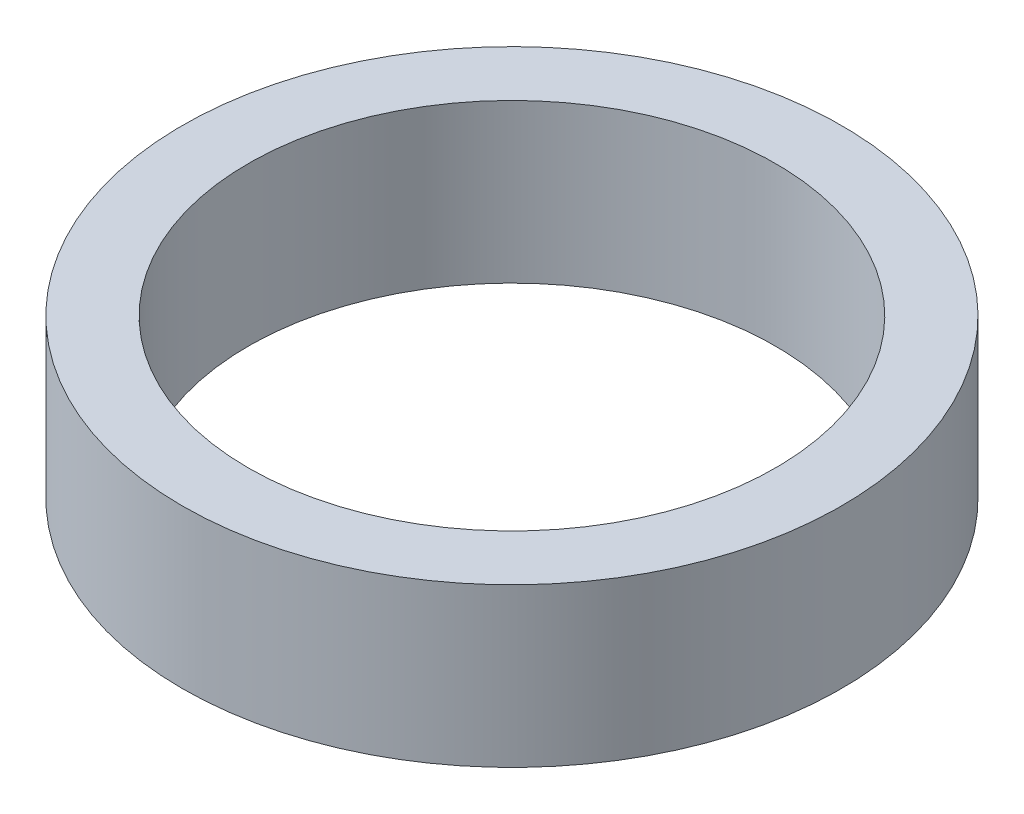
from build123d import *

# Parameters (mm, degrees)
SKETCH1_R           = 50
BOSS_EXTRUDE1_DEPTH = 24
SKETCH2_R           = 40
CUT_EXTRUDE1_DEPTH  = 75.67261881


with BuildPart() as part:
    # Sketch1 → Boss-Extrude1 (new body)
    with BuildSketch(Plane(origin=(0, 0, 0), x_dir=(1, 0, 0), z_dir=(0, 1, 0))):
        Circle(SKETCH1_R)
    extrude(amount=BOSS_EXTRUDE1_DEPTH)

    # Sketch2 → Cut-Extrude1 (cut, through all)
    with BuildSketch(Plane(origin=(0, 0, 0), x_dir=(1, 0, 0), z_dir=(0, 1, 0))):
        Circle(SKETCH2_R)
    extrude(amount=CUT_EXTRUDE1_DEPTH, mode=Mode.SUBTRACT)


solid = part.part
